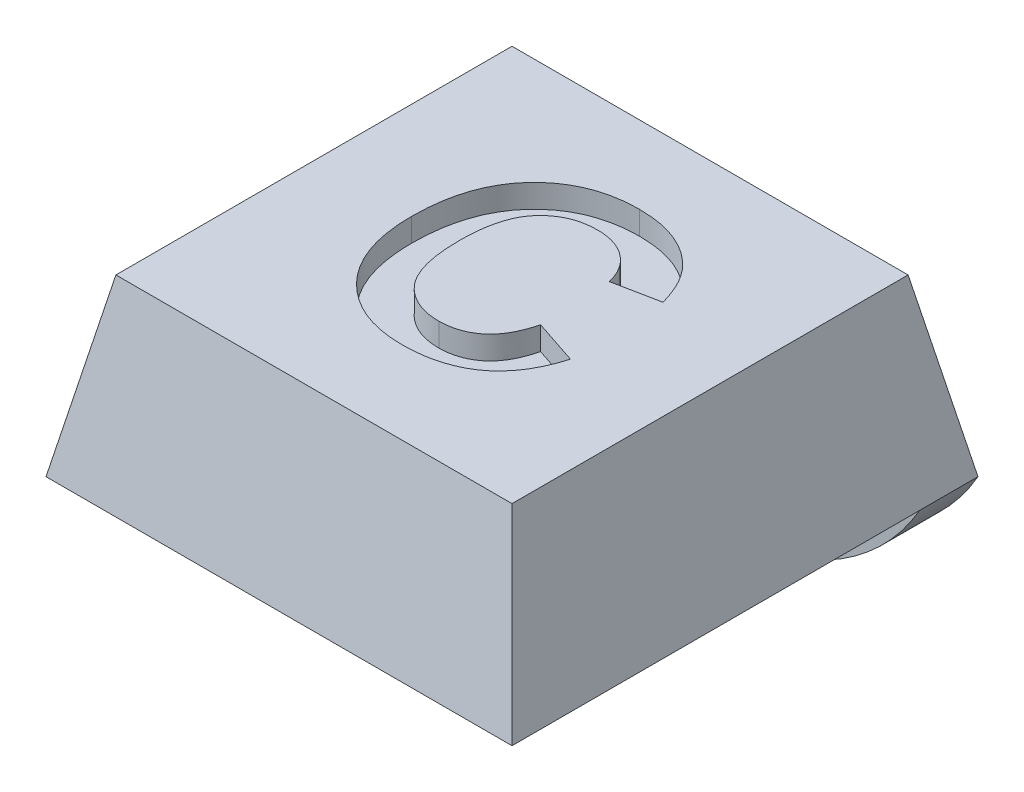
from build123d import *

# Parameters (mm, degrees)
SKETCH1_W               = 8
SKETCH1_H               = 8
BOSS_EXTRUDE1_DEPTH     = 3
CUT_EXTRUDE1_DEPTH      = 12.704699911
CUT_EXTRUDE1_DEPTH_BACK = 12.704699911
CUT_EXTRUDE2_DEPTH      = 11
SKETCH4_R               = 1.8
CUT_EXTRUDE3_DEPTH      = 0.8
SKETCH5_W               = 8
SKETCH5_H               = 1
BOSS_EXTRUDE2_DEPTH     = 2
FILLET1_R               = 4
CUT_EXTRUDE4_DEPTH      = 0.4


with BuildPart() as part:
    # Sketch1 → Boss-Extrude1 (new body)
    with BuildSketch(Plane(origin=(0, 0, 0), x_dir=(1, 0, 0), z_dir=(0, 1, 0))):
        with Locations((4, 4)):
            Rectangle(SKETCH1_W, SKETCH1_H)
    extrude(amount=BOSS_EXTRUDE1_DEPTH)

    # Sketch2 → Cut-Extrude1 (cut, two sides: drawn at the far end of the back side and taken through both)
    with BuildSketch(Plane.XY.offset(-CUT_EXTRUDE1_DEPTH_BACK)):
        Polygon((0, 0), (0.6, 3), (0, 3), align=None)
        Polygon((8, 0), (7.4, 3), (8, 3), align=None)
    extrude(amount=CUT_EXTRUDE1_DEPTH + CUT_EXTRUDE1_DEPTH_BACK, mode=Mode.SUBTRACT)

    # Sketch3 → Cut-Extrude2 (cut)
    with BuildSketch(Plane(origin=(0, 0, 0), x_dir=(0, 0, -1), z_dir=(1, 0, 0))):
        Polygon((0, 0), (0.6, 3), (0, 3), align=None)
        Polygon((8, 3), (7.4, 3), (8, 0), align=None)
    extrude(amount=CUT_EXTRUDE2_DEPTH, mode=Mode.SUBTRACT)

    # Sketch4 → Cut-Extrude3 (cut)
    with BuildSketch(Plane.XZ):
        with Locations(Location((4, -3.75, 0), (0, 0, 270))):
            Circle(SKETCH4_R)
    extrude(amount=-CUT_EXTRUDE3_DEPTH, mode=Mode.SUBTRACT)

    # Sketch5 → Boss-Extrude2 (add)
    with BuildSketch(Plane.XZ):
        with Locations((4, -7.5)):
            Rectangle(SKETCH5_W, SKETCH5_H)
    extrude(amount=BOSS_EXTRUDE2_DEPTH)

    # Fillet1
    # the kernel refuses this fillet: 4 mm, written as the material it takes off along each edge
    with BuildSketch(Plane(origin=(8, -2, -16.660254038), x_dir=(0, 1, 0), z_dir=(0, 0, 1)), Plane(origin=(0, -2, 1.660254038), x_dir=(0, 1, 0), z_dir=(0, 0, -1))) as fillet1_piece_1:
        with BuildLine():
            CenterArc((4, 3.464101615), FILLET1_R, 180, 60)
            Line((0, 3.464101615), (-0.08, 3.464101615))
            Line((-0.08, 3.464101615), (-0.08, 0))
            Line((-0.08, 0), (0, -0.08))
            ThreePointArc((0, -0.08), (1, -0.08), (1.96, -0.069282032))
            Line((1.96, -0.069282032), (2, 0))
        make_face()
    extrude(amount=18.320508076, mode=Mode.SUBTRACT)

    # Sketch6 → Cut-Extrude4 (cut)
    with BuildSketch(Plane(origin=(0, 3, 0), x_dir=(1, 0, 0), z_dir=(0, 1, 0))):
        with BuildLine():
            Line((4.984953699, 3.505457585), (5.754184468, 3.249047329))
            add(Edge.make_bspline(
                [(5.754184468, 3.249047329), (5.738551331, 3.198610805), (5.707936732, 3.099840225), (5.651723194, 2.958278532), (5.587443886, 2.827086856), (5.517410433, 2.704729688), (5.437267593, 2.594367909), (5.351502188, 2.492347505), (5.25756407, 2.400817223), (5.155916755, 2.319581611), (5.047538657, 2.247743191), (4.931170847, 2.187011676), (4.808549951, 2.134705195), (4.678432524, 2.092325917), (4.541682112, 2.058386549), (4.397657073, 2.035969411), (4.247031142, 2.020769852), (4.144181592, 2.01912185), (4.091524212, 2.018278098)],
                knots=[0, 0, 0, 0, 1.126640671, 2.206316847, 3.246446654, 4.24268115, 5.210795778, 6.153057602, 7.084219323, 8.004711971, 8.926421631, 9.854560063, 10.802134612, 11.768317461, 12.772025444, 13.805668576, 14.876536225, 16, 16, 16, 16], degree=3))
            add(Edge.make_bspline(
                [(4.091524212, 2.018278098), (4.026529436, 2.019622049), (3.898682769, 2.022265641), (3.711719127, 2.048877042), (3.533551231, 2.090397174), (3.363924198, 2.147881075), (3.203970267, 2.224018355), (3.052230113, 2.31567777), (2.909808045, 2.424720155), (2.777203704, 2.549307725), (2.656729454, 2.688489389), (2.552550394, 2.841513049), (2.46353299, 3.006222974), (2.391584534, 3.18340452), (2.335325697, 3.372875751), (2.295916265, 3.574374695), (2.271256348, 3.787964822), (2.268446864, 3.934340923), (2.267004981, 4.009463995)],
                knots=[0, 0, 0, 0, 1.025049111, 2.016302254, 2.973197159, 3.90886983, 4.83646737, 5.763135642, 6.70136783, 7.661478232, 8.629732022, 9.600038443, 10.576877021, 11.5787097, 12.612181225, 13.690866959, 14.814907849, 16, 16, 16, 16], degree=3))
            add(Edge.make_bspline(
                [(2.267004981, 4.009463995), (2.268440364, 4.088592426), (2.271240535, 4.242957555), (2.295946649, 4.467391238), (2.33430142, 4.6789069), (2.390655342, 4.87619306), (2.461546504, 5.060638151), (2.550671985, 5.230411199), (2.653811862, 5.387775744), (2.773739341, 5.529847487), (2.90694801, 5.655987983), (3.049697575, 5.767530284), (3.203319761, 5.861106277), (3.366973913, 5.937627827), (3.540879519, 5.996843969), (3.724694381, 6.039484239), (3.918568892, 6.064303618), (4.051121857, 6.067784001), (4.118767802, 6.069560149)],
                knots=[0, 0, 0, 0, 1.212648312, 2.365655595, 3.457000981, 4.504219827, 5.506356588, 6.480637568, 7.437950897, 8.385265166, 9.323599949, 10.245787653, 11.157260172, 12.074946661, 13.00980897, 13.968233668, 14.963125779, 16, 16, 16, 16], degree=3))
            add(Edge.make_bspline(
                [(4.118767802, 6.069560149), (4.177845619, 6.068071541), (4.293675542, 6.065152928), (4.463296702, 6.045323759), (4.624050093, 6.010524892), (4.776804639, 5.963554159), (4.920690778, 5.901565287), (5.05596628, 5.825815524), (5.18309612, 5.736705664), (5.259694467, 5.667100309), (5.298254981, 5.632060149)],
                knots=[0, 0, 0, 0, 1.098510076, 2.153775193, 3.169777012, 4.153122333, 5.120892526, 6.076995459, 7.031936742, 8, 8, 8, 8], degree=3))
            add(Edge.make_bspline(
                [(5.298254981, 5.632060149), (5.320604149, 5.60976374), (5.365827451, 5.564647194), (5.426213252, 5.488477681), (5.483466493, 5.406481188), (5.536678451, 5.317258958), (5.58416733, 5.220136739), (5.628218337, 5.11660602), (5.668774447, 5.006267724), (5.691328308, 4.929479087), (5.702902417, 4.89007297)],
                knots=[0, 0, 0, 0, 0.885292881, 1.791380647, 2.722937556, 3.69093542, 4.703306561, 5.754477758, 6.847650944, 8, 8, 8, 8], degree=3))
            Line((5.702902417, 4.89007297), (4.933671648, 4.736226816))
            add(Edge.make_bspline(
                [(4.933671648, 4.736226816), (4.927133502, 4.76145763), (4.914255072, 4.811155713), (4.888197319, 4.88256913), (4.858307022, 4.950334085), (4.821260737, 5.012790777), (4.781908002, 5.072717729), (4.735316585, 5.127453998), (4.684461977, 5.178434101), (4.62897783, 5.22512899), (4.569525593, 5.266595122), (4.507249934, 5.303870591), (4.441018967, 5.334299022), (4.371713727, 5.358915551), (4.29961025, 5.379554656), (4.224066596, 5.392304393), (4.145731594, 5.40209207), (4.092359182, 5.40262243), (4.065081904, 5.402893482)],
                knots=[0, 0, 0, 0, 1.051226935, 2.070641259, 3.064374968, 4.034983734, 4.997599858, 5.953980297, 6.92954377, 7.901109626, 8.875958313, 9.851998019, 10.826131395, 11.811470594, 12.818270757, 13.847890818, 14.900111925, 16, 16, 16, 16], degree=3))
            add(Edge.make_bspline(
                [(4.065081904, 5.402893482), (4.027621622, 5.402136956), (3.95451036, 5.400660441), (3.84764705, 5.384198307), (3.745794169, 5.361223694), (3.649362485, 5.32614158), (3.558949174, 5.281271846), (3.473526684, 5.226727667), (3.393563858, 5.162742669), (3.319033671, 5.088558841), (3.252152959, 5.002834902), (3.193355266, 4.905393862), (3.144577309, 4.795129453), (3.104977365, 4.673123713), (3.073807698, 4.539086512), (3.051550102, 4.39284594), (3.039240982, 4.234301954), (3.037259111, 4.124602201), (3.03623575, 4.067957585)],
                knots=[0, 0, 0, 0, 0.938194206, 1.831074359, 2.704771284, 3.551924377, 4.396294915, 5.230222094, 6.087631332, 6.958733431, 7.860107878, 8.806247581, 9.804197948, 10.875520245, 12.017191412, 13.250061517, 14.580040491, 16, 16, 16, 16], degree=3))
            add(Edge.make_bspline(
                [(3.03623575, 4.067957585), (3.037249034, 4.007841988), (3.039201475, 3.892008492), (3.051507983, 3.724929387), (3.073907907, 3.571260811), (3.104663329, 3.430730056), (3.144462832, 3.303423199), (3.1931583, 3.189560541), (3.251047919, 3.089008738), (3.318041624, 3.001834743), (3.3924457, 2.926952551), (3.472244969, 2.862570915), (3.55696863, 2.80752487), (3.647126515, 2.762236533), (3.743061533, 2.72797641), (3.843985242, 2.703130369), (3.950267946, 2.687335345), (4.023091528, 2.685752793), (4.060274212, 2.684944765)],
                knots=[0, 0, 0, 0, 1.475208372, 2.842499301, 4.107722225, 5.282836115, 6.369007568, 7.375918121, 8.315702116, 9.208439171, 10.065831443, 10.90006451, 11.71996243, 12.54067204, 13.369972975, 14.214060185, 15.088124569, 16, 16, 16, 16], degree=3))
            add(Edge.make_bspline(
                [(4.060274212, 2.684944765), (4.087802914, 2.685631562), (4.141934021, 2.686982048), (4.22194397, 2.695553476), (4.298737204, 2.711910812), (4.3726896, 2.733540427), (4.444088489, 2.760679214), (4.511844803, 2.795492821), (4.577291618, 2.835505891), (4.639070965, 2.882398144), (4.6980101, 2.93504365), (4.751766089, 2.995888735), (4.801629231, 3.063471428), (4.846966938, 3.138243387), (4.889294086, 3.219564589), (4.92530624, 3.308702064), (4.958854788, 3.404215308), (4.976102112, 3.471120718), (4.984953699, 3.505457585)],
                knots=[0, 0, 0, 0, 0.980177776, 1.927374078, 2.859849964, 3.771585772, 4.668674471, 5.574490016, 6.479656464, 7.396337719, 8.332153134, 9.288470092, 10.28125149, 11.318486971, 12.398724812, 13.541284404, 14.738150009, 16, 16, 16, 16], degree=3))
        make_face()
    extrude(amount=-CUT_EXTRUDE4_DEPTH, mode=Mode.SUBTRACT)


solid = part.part
